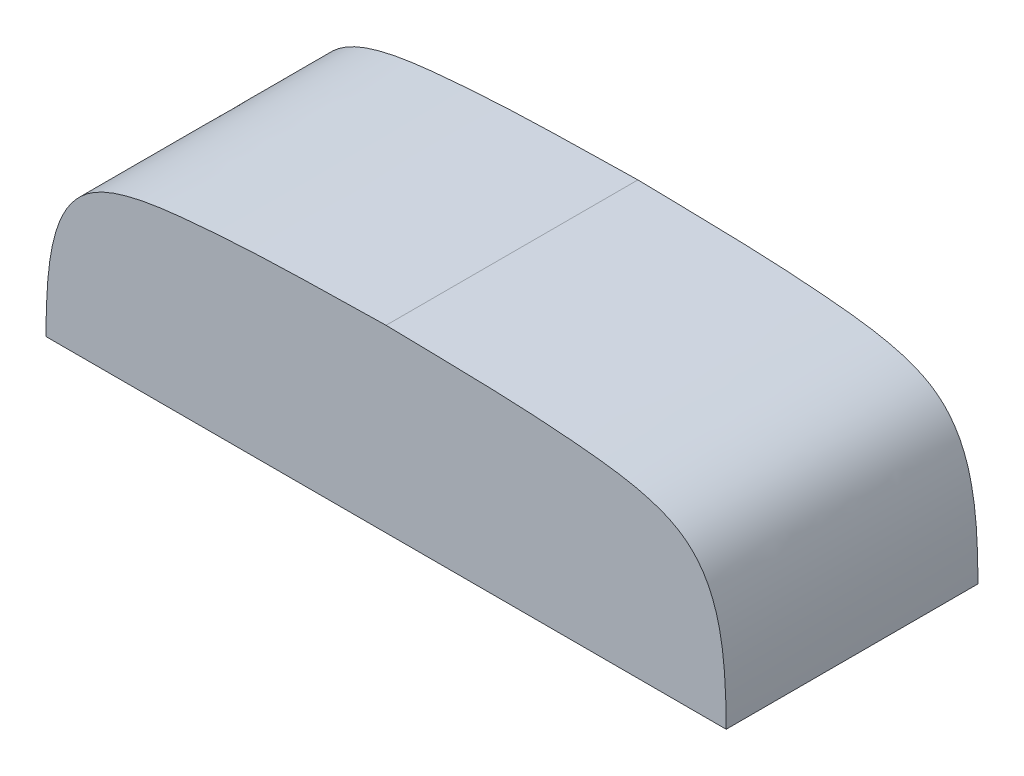
from build123d import *

# Parameters (mm, degrees)
BOSS_EXTRUDE1_DEPTH      = 127
BOSS_EXTRUDE1_DEPTH_BACK = 127


with BuildPart() as part:
    # Sketch1 → Boss-Extrude1 (new, two sides: drawn at the far end of the back side and taken through both)
    with BuildSketch(Plane.XY.offset(-BOSS_EXTRUDE1_DEPTH_BACK)):
        with BuildLine():
            Line((343.046678298, 50.863822519), (-343.046678298, 50.863822519))
            add(Edge.make_bspline(
                [(0, 232.258315543), (-64.976578003, 230.629837071), (-157.61608025, 231.097052488), (-335.02600023, 207.30289309), (-342.768013695, 116.178819585), (-343.046678298, 50.863822519)],
                knots=[0, 0, 0, 0, 0.225226498, 0.337839747, 0.524743478, 0.524743478, 0.524743478, 0.524743478], degree=3))
            add(Edge.make_bspline(
                [(0, 232.258315543), (64.976578003, 230.629837071), (157.61608025, 231.097052488), (335.02600023, 207.30289309), (342.768013695, 116.178819585), (343.046678298, 50.863822519)],
                knots=[0, 0, 0, 0, 0.225226498, 0.337839747, 0.524743478, 0.524743478, 0.524743478, 0.524743478], degree=3))
        make_face()
    extrude(amount=BOSS_EXTRUDE1_DEPTH + BOSS_EXTRUDE1_DEPTH_BACK)


solid = part.part
